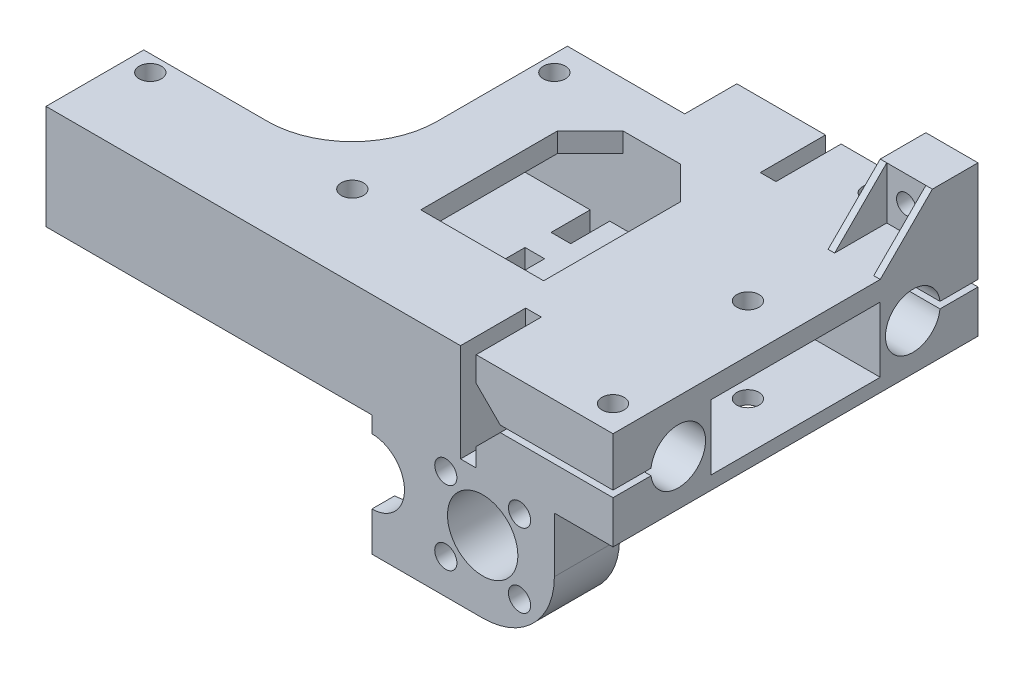
from build123d import *

# Parameters (mm, degrees)
SKETCH_1_R           = 1.7
SKETCH_1_R_2         = 5.4
EXTRUDE_1_DEPTH      = 10
EXTRUDE_START        = -10
EXTRUDE_2_DEPTH      = 10
CUT_EXTRUDE_1_DEPTH  = 2
EXTRUDE_START_2      = -46
EXTRUDE_3_DEPTH      = 36
EXTRUDE_START_3      = 6.5
EXTRUDE_4_DEPTH      = 3.5
EXTRUDE_5_DEPTH      = 4
SKETCH_1_10_W        = 8
SKETCH_1_10_H        = 8
SKETCH_1_10_R        = 1.5
EXTRUDE_6_DEPTH      = 7
RIB_2_REACH          = 105.331
SKETCH_4_WALL_W      = 219.975267576
SKETCH_4_WALL_H      = 1
RIB_START            = -1
RIB_3_DEPTH          = 1
EXTRUDE_START_4      = -0.4
SKETCH_6_R           = 1.5
EXTRUDE_7_DEPTH      = 0.4
SKETCH_7_R           = 1.7
SKETCH_7_R_2         = 1.35
CUT_EXTRUDE_2_DEPTH  = 89.290712988
SKETCH_8_W           = 26
SKETCH_8_H           = 10
CUT_EXTRUDE_3_DEPTH  = 105.174133066
CUT_EXTRUDE_4_DEPTH  = 22
CUT_EXTRUDE_5_DEPTH  = 24
SKETCH_7_4_W         = 2.4
SKETCH_7_4_H         = 10
CUT_EXTRUDE_9_DEPTH  = 15.05
CHAMFER_1_SIZE       = 3.7
CUT_EXTRUDE_START    = -17.562916
SKETCH_7_5_W         = 3
SKETCH_7_5_H         = 6
CUT_EXTRUDE_10_DEPTH = 17.562916
CUT_EXTRUDE_11_REACH = 90.291
CHAMFER_2_SIZE       = 5
CHAMFER_3_SIZE       = 2
CHAMFER_3_SIZE2      = 2.5
SKETCH_9_W           = 11.322924712
SKETCH_9_H           = 24.282583949
CUT_EXTRUDE_12_DEPTH = 93.82914413
CUT_EXTRUDE_START_2  = -49
SKETCH_1_14_R        = 1.5
CUT_EXTRUDE_13_DEPTH = 10


# Read off the part's stored shape, not the designer's step: 筋3
with BuildPart() as part:
    # 草图1 → 凸台-拉伸1 (new body)
    with BuildSketch(Plane.XY):
        with BuildLine():
            Line((-17, -7.5), (-17, -11))
            Line((-17, -11), (0, -11))
            ThreePointArc((0, -11), (7.778174593, -7.778174593), (11, 0))
            Line((11, 0), (11, 8.456854249))
            Line((11, 8.456854249), (28, 8.456854249))
            Line((28, 8.456854249), (28, 10.5))
            Line((28, 10.5), (21, 10.5))
            Line((21, 10.5), (21, 20.5))
            Line((21, 20.5), (28, 20.5))
            Line((28, 20.5), (28, 23.5))
            Line((28, 23.5), (-67, 23.5))
            Line((-67, 23.5), (-67, 7.5))
            Line((-67, 7.5), (-17, 7.5))
            ThreePointArc((-17, 7.5), (-9.5, 0), (-17, -7.5))
        make_face()
        with Locations((-5.656854249, -5.656854249)):
            Circle(SKETCH_1_R, mode=Mode.SUBTRACT)
        with Locations((5.656854249, -5.656854249)):
            Circle(SKETCH_1_R, mode=Mode.SUBTRACT)
        Circle(SKETCH_1_R_2, mode=Mode.SUBTRACT)
        with Locations((-5.656854249, 5.656854249)):
            Circle(SKETCH_1_R, mode=Mode.SUBTRACT)
        with Locations((5.656854249, 5.656854249)):
            Circle(SKETCH_1_R, mode=Mode.SUBTRACT)
    extrude(amount=EXTRUDE_1_DEPTH)

    # 草图1<6> → 凸台-拉伸2 (add)
    with BuildSketch(Plane.XY.offset(EXTRUDE_START)):
        with BuildLine():
            Line((21, 10.5), (21, 20.5))
            Line((21, 20.5), (28, 20.5))
            Line((28, 20.5), (28, 23.5))
            Line((28, 23.5), (-67, 23.5))
            Line((-67, 23.5), (-67, 7.5))
            Line((-67, 7.5), (-17, 7.5))
            ThreePointArc((-17, 7.5), (-9.5, 0), (-17, -7.5))
            Line((-17, -7.5), (-17, -11))
            ThreePointArc((-17, -11), (-8.462447466, -5.036106671), (-8.643737412, 5.376624039))
            ThreePointArc((-8.643737412, 5.376624039), (-7.46899014, 8.047704206), (-4.579821288, 8.456854249))
            Line((-4.579821288, 8.456854249), (28, 8.456854249))
            Line((28, 8.456854249), (28, 10.5))
            Line((28, 10.5), (21, 10.5))
        make_face()
    extrude(amount=EXTRUDE_2_DEPTH)

    # 草图3 → 切除-拉伸1 (cut)
    with BuildSketch(Plane(origin=(0, 0, 0), x_dir=(-1, 0, 0), z_dir=(0, 0, -1))):
        Polygon((7.919595949, 3.39411255), (8.747816894, 6.485075194), (6.485075194, 8.747816894), (3.39411255, 7.919595949), (2.565891605, 4.828633305), (4.828633305, 2.565891605), align=None)
        Polygon((-2.565891605, 4.828633305), (-3.39411255, 7.919595949), (-6.485075194, 8.747816894), (-8.747816894, 6.485075194), (-7.919595949, 3.39411255), (-4.828633305, 2.565891605), align=None)
        Polygon((-3.39411255, -7.919595949), (-2.565891605, -4.828633305), (-4.828633305, -2.565891605), (-7.919595949, -3.39411255), (-8.747816894, -6.485075194), (-6.485075194, -8.747816894), align=None)
        Polygon((2.565891605, -4.828633305), (3.39411255, -7.919595949), (6.485075194, -8.747816894), (8.747816894, -6.485075194), (7.919595949, -3.39411255), (4.828633305, -2.565891605), align=None)
    extrude(amount=-CUT_EXTRUDE_1_DEPTH, mode=Mode.SUBTRACT)

    # 草图1<7> → 凸台-拉伸3 (add)
    with BuildSketch(Plane.XY.offset(EXTRUDE_START_2)):
        with BuildLine():
            Line((21, 8.456854249), (21, 23.5))
            Line((21, 23.5), (-67, 23.5))
            Line((-67, 23.5), (-67, 7.5))
            Line((-67, 7.5), (-17, 7.5))
            ThreePointArc((-17, 7.5), (-9.5, 0), (-17, -7.5))
            Line((-17, -7.5), (-17, -11))
            ThreePointArc((-17, -11), (-8.462447466, -5.036106671), (-8.643737412, 5.376624039))
            ThreePointArc((-8.643737412, 5.376624039), (-7.46899014, 8.047704206), (-4.579821288, 8.456854249))
            Line((-4.579821288, 8.456854249), (21, 8.456854249))
        make_face()
    extrude(amount=EXTRUDE_3_DEPTH)

    # 草图1<8> → 凸台-拉伸4 (add)
    with BuildSketch(Plane.XY.offset(EXTRUDE_START_3)):
        with BuildLine():
            Line((-17, -5), (-17, -7.5))
            ThreePointArc((-17, -7.5), (-9.5, 0), (-17, 7.5))
            Line((-17, 7.5), (-17, 5))
            ThreePointArc((-17, 5), (-12, 0), (-17, -5))
        make_face()
    extrude(amount=EXTRUDE_4_DEPTH)

    # 草图1<9> → 凸台-拉伸5 (add)
    with BuildSketch(Plane.XY.offset(EXTRUDE_START_2)):
        with BuildLine():
            Line((-17, -5), (-17, -7.5))
            ThreePointArc((-17, -7.5), (-9.5, 0), (-17, 7.5))
            Line((-17, 7.5), (-17, 5))
            ThreePointArc((-17, 5), (-12, 0), (-17, -5))
        make_face()
    extrude(amount=EXTRUDE_5_DEPTH)

    # 草图1<10> → 凸台-拉伸6 (add)
    with BuildSketch(Plane.XY.offset(EXTRUDE_START_2)):
        with Locations((16, 27.5)):
            Rectangle(SKETCH_1_10_W, SKETCH_1_10_H)
        with Locations((16, 27.5)):
            Circle(SKETCH_1_10_R, mode=Mode.SUBTRACT)
    extrude(amount=EXTRUDE_6_DEPTH)

    # 草图4 wall → 筋2 (add, up to next)
    with BuildSketch(Plane(origin=(20, 27.5, -35), x_dir=(0, -0.707106781187, 0.707106781187), z_dir=(0, -0.707106781187, -0.707106781187)), mode=Mode.PRIVATE) as rib_2_sk1:
        with Locations((0, 0.5)):
            Rectangle(SKETCH_4_WALL_W, SKETCH_4_WALL_H)
    rib_2_tool1 = extrude(rib_2_sk1.sketch, amount=RIB_2_REACH, mode=Mode.PRIVATE) - part.part
    add(rib_2_tool1.solids().sort_by_distance((20, 27.5, -35))[0])

    # 筋3 outline → 筋3 (add)
    with BuildSketch(Plane.ZY.offset(-12).offset(RIB_START)):
        Polygon((-31, 23.5), (-39, 31.5), (-39, 23.5), align=None)
    extrude(amount=RIB_3_DEPTH)

    # 草图6 → 凸台-拉伸7 (add)
    with BuildSketch(Plane.XY.offset(-39).offset(EXTRUDE_START_4)):
        with Locations((16, 27.5)):
            Circle(SKETCH_6_R)
    extrude(amount=EXTRUDE_7_DEPTH)

    # 草图7 → 切除-拉伸2 (cut, through all)
    with BuildSketch(Plane(origin=(0, 23.5, 0), x_dir=(1, 0, 0), z_dir=(0, 1, 0))):
        with BuildLine():
            Line((-17, 38), (-17, 46))
            Line((-17, 46), (-69, 46))
            Line((-69, 46), (-69, 5))
            Line((-69, 5), (-48, 5))
            ThreePointArc((-48, 5), (-38.807611845, 8.807611845), (-35, 18))
            Line((-35, 18), (-35, 38))
            Line((-35, 38), (-17, 38))
        make_face()
        with Locations(Location((12.7, 18, 0), (0, 0, 180))):
            Circle(SKETCH_7_R)
        with Locations(Location((16, -6, 0), (0, 0, 180))):
            Circle(SKETCH_7_R)
        with Locations(Location((8, 42, 0), (0, 0, 180))):
            Circle(SKETCH_7_R)
        with Locations(Location((-32.5, 2.5, 0), (0, 0, 180))):
            Circle(SKETCH_7_R)
        with Locations(Location((-63.5, 2.5, 0), (0, 0, 180))):
            Circle(SKETCH_7_R)
        with Locations(Location((-32.5, 33.5, 0), (0, 0, 180))):
            Circle(SKETCH_7_R)
        with Locations(Location((24.5, -5, 0), (0, 0, 180))):
            Circle(SKETCH_7_R_2)
        with Locations(Location((24.5, 5, 0), (0, 0, 270))):
            Circle(SKETCH_7_R_2)
    extrude(amount=-CUT_EXTRUDE_2_DEPTH, mode=Mode.SUBTRACT)

    # 草图8 → 切除-拉伸3 (cut, through all)
    with BuildSketch(Plane(origin=(21, 0, 0), x_dir=(0, 0, -1), z_dir=(1, 0, 0))):
        with Locations((18, 15.5)):
            Rectangle(SKETCH_8_W, SKETCH_8_H)
    extrude(amount=-CUT_EXTRUDE_3_DEPTH, mode=Mode.SUBTRACT)

    # 草图8<3> → 切除-拉伸4 (cut)
    with BuildSketch(Plane(origin=(21, 0, 0), x_dir=(0, 0, -1), z_dir=(1, 0, 0))):
        with BuildLine():
            ThreePointArc((36, 19.7), (31.8, 15.5), (36, 11.3))
            Line((36, 11.3), (36, 19.7))
        make_face()
        with BuildLine():
            ThreePointArc((4.2, 15.5), (2.969848481, 18.469848481), (0, 19.7))
            Line((0, 19.7), (0, 11.3))
            ThreePointArc((0, 11.3), (2.969848481, 12.530151519), (4.2, 15.5))
        make_face()
    extrude(amount=-CUT_EXTRUDE_4_DEPTH, mode=Mode.SUBTRACT)

    # 草图8<4> → 切除-拉伸5 (cut)
    with BuildSketch(Plane(origin=(21, 0, 0), x_dir=(0, 0, -1), z_dir=(1, 0, 0))):
        with BuildLine():
            Line((0, 11.3), (0, 19.7))
            ThreePointArc((0, 19.7), (-2.787471973, 18.641655614), (-4.170131892, 16))
            Line((-4.170131892, 16), (-10, 16))
            Line((-10, 16), (-10, 15))
            Line((-10, 15), (-4.170131892, 15))
            ThreePointArc((-4.170131892, 15), (-2.787471973, 12.358344386), (0, 11.3))
        make_face()
        with BuildLine():
            Line((40.170131892, 15), (46, 15))
            Line((46, 15), (46, 16))
            Line((46, 16), (40.170131892, 16))
            ThreePointArc((40.170131892, 16), (38.787471973, 18.641655614), (36, 19.7))
            Line((36, 19.7), (36, 11.3))
            ThreePointArc((36, 11.3), (38.787471973, 12.358344386), (40.170131892, 15))
        make_face()
    extrude(amount=-CUT_EXTRUDE_5_DEPTH, mode=Mode.SUBTRACT)

    # 草图7<4> → 切除-拉伸9 (cut)
    with BuildSketch(Plane(origin=(0, 23.5, 0), x_dir=(1, 0, 0), z_dir=(0, 1, 0))):
        with Locations((-2.2, -5)):
            Rectangle(SKETCH_7_4_W, SKETCH_7_4_H)
        with Locations((-2.2, 41)):
            Rectangle(SKETCH_7_4_W, SKETCH_7_4_H)
    extrude(amount=-CUT_EXTRUDE_9_DEPTH, mode=Mode.SUBTRACT)

    # 倒角1
    chamfer_1_edges = [part.edges().sort_by_distance(p)[0] for p in [
        (-1, 16, -43.085065946),
        (-1, 15, -43.085065946),
        (-1, 16, 7.085065946),
        (-1, 15, 7.085065946),
    ]]
    chamfer(chamfer_1_edges, length=CHAMFER_1_SIZE)

    # 草图7<5> → 切除-拉伸10 (cut)
    with BuildSketch(Plane(origin=(0, 23.5, 0), x_dir=(1, 0, 0), z_dir=(0, 1, 0)).offset(CUT_EXTRUDE_START)):
        with Locations((-7.143737412, 18)):
            Rectangle(SKETCH_7_5_W, SKETCH_7_5_H)
        with Locations((-7.143737412, 28)):
            Rectangle(SKETCH_7_5_W, SKETCH_7_5_H)
        with Locations((-23, 28)):
            Rectangle(SKETCH_7_5_W, SKETCH_7_5_H)
        with Locations((-23, 18)):
            Rectangle(SKETCH_7_5_W, SKETCH_7_5_H)
        with Locations((-23, 8)):
            Rectangle(SKETCH_7_5_W, SKETCH_7_5_H)
        with Locations((-7.143737412, 8)):
            Rectangle(SKETCH_7_5_W, SKETCH_7_5_H)
    extrude(amount=CUT_EXTRUDE_10_DEPTH, mode=Mode.SUBTRACT)

    # 草图7<6> → 切除-拉伸11 (cut, up to next)
    with BuildSketch(Plane(origin=(0, 23.5, 0), x_dir=(1, 0, 0), z_dir=(0, 1, 0)), mode=Mode.PRIVATE) as cut_extrude_11_sk1:
        Polygon((-21.5, 5), (-8.643737412, 5), (-8.643737412, 11), (-5.643737412, 11), (-5.643737412, 15), (-8.643737412, 15), (-8.643737412, 21), (-5.643737412, 21), (-5.643737412, 25), (-8.643737412, 25), (-8.643737412, 31), (-21.5, 31), (-21.5, 25), (-24.5, 25), (-24.5, 21), (-21.5, 21), (-21.5, 15), (-24.5, 15), (-24.5, 11), (-21.5, 11), align=None)
    cut_extrude_11_tool1 = extrude(cut_extrude_11_sk1.sketch, amount=-CUT_EXTRUDE_11_REACH, mode=Mode.PRIVATE) & part.part
    add(cut_extrude_11_tool1.solids().sort_by_distance((-15.071869, 23.5, -18))[0], mode=Mode.SUBTRACT)

    # 倒角2
    chamfer_2_edges = [part.edges().sort_by_distance(p)[0] for p in [
        (-5.643737412, 22, -31),
        (-24.5, 22, -31),
    ]]
    chamfer(chamfer_2_edges, length=CHAMFER_2_SIZE)

    # 倒角3
    chamfer_3_edges = [part.edges().sort_by_distance(p)[0] for p in [
        (-12, 0, -42),
    ]]
    chamfer_3_side = [part.faces().sort_by_distance(p)[0] for p in [
        (-9.667705098, 0, -42),
    ]]
    chamfer(chamfer_3_edges, length=CHAMFER_3_SIZE, length2=CHAMFER_3_SIZE2, reference=chamfer_3_side[0])

    # 草图9 → 切除-拉伸12 (cut, through all)
    with BuildSketch(Plane.XY.offset(10)):
        with Locations((25.661462356, 19.358708026)):
            Rectangle(SKETCH_9_W, SKETCH_9_H)
    extrude(amount=-CUT_EXTRUDE_12_DEPTH, mode=Mode.SUBTRACT)

    # 草图1<14> → 切除-拉伸13 (cut)
    with BuildSketch(Plane.XY.offset(CUT_EXTRUDE_START_2)):
        with Locations((16, 27.5)):
            Circle(SKETCH_1_14_R)
    extrude(amount=CUT_EXTRUDE_13_DEPTH, mode=Mode.SUBTRACT)


solid = part.part
